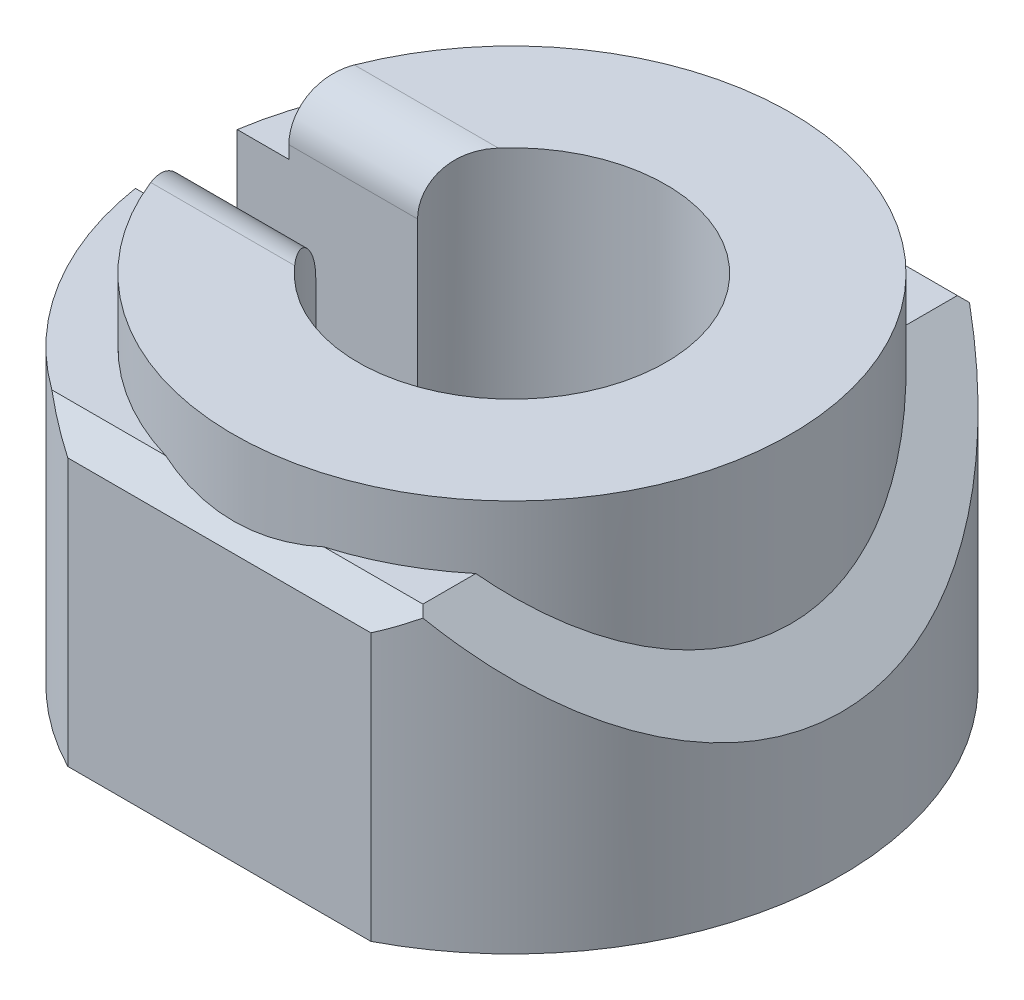
from build123d import *

# Parameters (mm, degrees)
SKETCH1_R               = 10.95
SKETCH1_R_2             = 6.05
BOSS_EXTRUDE1_DEPTH     = 2
BOSS_EXTRUDE2_START     = 12
SKETCH1_3_R             = 10.95
SKETCH1_3_R_2           = 6.05
BOSS_EXTRUDE2_DEPTH     = 12
BOSS_EXTRUDE3_START     = -2.5
SKETCH2_R               = 12.95
SKETCH2_R_2             = 10.95
BOSS_EXTRUDE3_DEPTH     = 11.5
CUT_EXTRUDE1_DEPTH      = 22.895319134
CUT_EXTRUDE1_DEPTH_BACK = 22.895319134
SKETCH3_W               = 100
SKETCH3_H               = 23
CUT_EXTRUDE3_DEPTH      = 22.07018035
CUT_EXTRUDE3_DEPTH_BACK = 22.07018035
BOSS_EXTRUDE4_START     = 12
SKETCH1_5_R             = 10.95
SKETCH1_5_R_2           = 6.05
BOSS_EXTRUDE4_DEPTH     = 12
SKETCH5_W               = 18
SKETCH5_H               = 4
CUT_EXTRUDE4_DEPTH      = 22.07018035
FILLET1_R               = 2
CUT_EXTRUDE5_DEPTH      = 22.070180523
CUT_EXTRUDE5_DEPTH_BACK = 22.070180523
SKETCH6_R               = 1.6
CHAMFER1_SIZE           = 1


# Some blends are built 0.0001 mm under size
with BuildPart() as part:
    # Sketch1 → Boss-Extrude1 (new body)
    # profile 1 of 2: a face of its own
    with BuildSketch(Plane(origin=(0, 0, 0), x_dir=(1, 0, 0), z_dir=(0, 1, 0))):
        with Locations(Location((0, 0, 0), (0, 0, 270))):
            Circle(SKETCH1_R)
        Circle(SKETCH1_R_2, mode=Mode.SUBTRACT)
    # profile 2 of 2: a face of its own
    with BuildSketch(Plane(origin=(0, 0, 0), x_dir=(1, 0, 0), z_dir=(0, 1, 0))):
        Circle(SKETCH1_R_2)
    extrude(amount=-BOSS_EXTRUDE1_DEPTH)

    # Sketch1<3> → Boss-Extrude2 (add)
    with BuildSketch(Plane(origin=(0, 0, 0), x_dir=(1, 0, 0), z_dir=(0, 1, 0)).offset(BOSS_EXTRUDE2_START)):
        with Locations(Location((0, 0, 0), (0, 0, 270))):
            Circle(SKETCH1_3_R)
        with Locations(Location((0, 0, 0), (0, 0, 270))):
            Circle(SKETCH1_3_R_2, mode=Mode.SUBTRACT)
    extrude(amount=-BOSS_EXTRUDE2_DEPTH)

    # Sketch2 → Boss-Extrude3 (add)
    with BuildSketch(Plane(origin=(0, 12, 0), x_dir=(1, 0, 0), z_dir=(0, 1, 0)).offset(BOSS_EXTRUDE3_START)):
        with Locations(Location((0, 0, 0), (0, 0, 270))):
            Circle(SKETCH2_R)
        with Locations(Location((0, 0, 0), (0, 0, 270))):
            Circle(SKETCH2_R_2, mode=Mode.SUBTRACT)
    extrude(amount=-BOSS_EXTRUDE3_DEPTH)

    # Sketch3 → Cut-Extrude1 (cut, two sides: drawn at the far end of the back side and taken through both)
    with BuildSketch(Plane(origin=(0, 0, 0), x_dir=(1, 0, 0), z_dir=(0, 1, 0)).offset(-CUT_EXTRUDE1_DEPTH_BACK)):
        with Locations((0, -23)):
            Rectangle(SKETCH3_W, SKETCH3_H)
        with Locations((0, 23)):
            Rectangle(SKETCH3_W, SKETCH3_H)
    extrude(amount=CUT_EXTRUDE1_DEPTH + CUT_EXTRUDE1_DEPTH_BACK, mode=Mode.SUBTRACT)

    # Sketch4 → Cut-Extrude3 (cut, two sides: drawn at the far end of the back side and taken through both)
    with BuildSketch(Plane.XY.offset(-CUT_EXTRUDE3_DEPTH_BACK)):
        Polygon((13, 12), (4.5, 12), (13, 3.5), align=None)
    extrude(amount=CUT_EXTRUDE3_DEPTH + CUT_EXTRUDE3_DEPTH_BACK, mode=Mode.SUBTRACT)

    # Sketch1<5> → Boss-Extrude4 (add)
    with BuildSketch(Plane(origin=(0, 0, 0), x_dir=(1, 0, 0), z_dir=(0, 1, 0)).offset(BOSS_EXTRUDE4_START)):
        with Locations(Location((0, 0, 0), (0, 0, 270))):
            Circle(SKETCH1_5_R)
        with Locations(Location((0, 0, 0), (0, 0, 270))):
            Circle(SKETCH1_5_R_2, mode=Mode.SUBTRACT)
    extrude(amount=-BOSS_EXTRUDE4_DEPTH)

    # Sketch5 → Cut-Extrude4 (cut, through all)
    with BuildSketch(Plane(origin=(0, 0, 0), x_dir=(1, 0, 0), z_dir=(0, 1, 0))):
        with Locations((-11, 0)):
            Rectangle(SKETCH5_W, SKETCH5_H)
    extrude(amount=CUT_EXTRUDE4_DEPTH, mode=Mode.SUBTRACT)

    # Fillet1
    fillet1_edges = [part.edges().sort_by_distance(p)[0] for p in [
        (-8.237831116, 12, 2),
        (-8.237831116, 12, -2),
        (-9.252243836, 0, -2),
        (-9.252243836, 0, 2),
    ]]
    fillet(fillet1_edges, radius=FILLET1_R - 0.0001)  # a hair under: the kernel refuses the full size

    # Sketch6 → Cut-Extrude5 (cut, two sides: drawn at the far end of the back side and taken through both)
    with BuildSketch(Plane(origin=(0, 0, 0), x_dir=(1, 0, 0), z_dir=(0, 1, 0)).offset(-CUT_EXTRUDE5_DEPTH_BACK)):
        with Locations(Location((0, 0, 0), (0, 0, 270))):
            Circle(SKETCH6_R)
    extrude(amount=CUT_EXTRUDE5_DEPTH + CUT_EXTRUDE5_DEPTH_BACK, mode=Mode.SUBTRACT)

    # Chamfer1
    # the kernel refuses this chamfer: 1 mm, written as the material it takes off along each edge
    with BuildSketch(Plane(origin=(8.525883186, 9.5, 11.5), x_dir=(0, 0.027495876610585647, -0.9996219169112968), z_dir=(-1, 0, 0))) as chamfer1_piece_1_section:
        Polygon((CHAMFER1_SIZE * 0.999621916911, CHAMFER1_SIZE * 0.0274958766106), (-CHAMFER1_SIZE * 0.0274958766106, CHAMFER1_SIZE * 0.999621916911), (0, 0), align=None)
    chamfer1_piece_1 = extrude(amount=17.051766372, mode=Mode.PRIVATE)
    chamfer1_piece_1 = chamfer1_piece_1 - Plane(origin=(0, 9.159933663, 0), x_dir=(0, 0, 1), z_dir=(0, 1, 0)) * Cylinder(10.95, 39, mode=Mode.PRIVATE)
    add(chamfer1_piece_1, mode=Mode.SUBTRACT)
    with BuildSketch(Plane(origin=(8.525883186, 9.5, -11.5), x_dir=(0, 0.027495876610585647, 0.9996219169112968), z_dir=(-1, 0, 0))) as chamfer1_piece_2_section:
        Polygon((CHAMFER1_SIZE * 0.999621916911, -CHAMFER1_SIZE * 0.0274958766106), (-CHAMFER1_SIZE * 0.0274958766106, -CHAMFER1_SIZE * 0.999621916911), (0, 0), align=None)
    chamfer1_piece_2 = extrude(amount=17.051766372, mode=Mode.PRIVATE)
    chamfer1_piece_2 = chamfer1_piece_2 - Plane(origin=(0, 9.159933662, 0), x_dir=(0, 0, 1), z_dir=(0, 1, 0)) * Cylinder(10.95, 39, mode=Mode.PRIVATE)
    add(chamfer1_piece_2, mode=Mode.SUBTRACT)


solid = part.part
